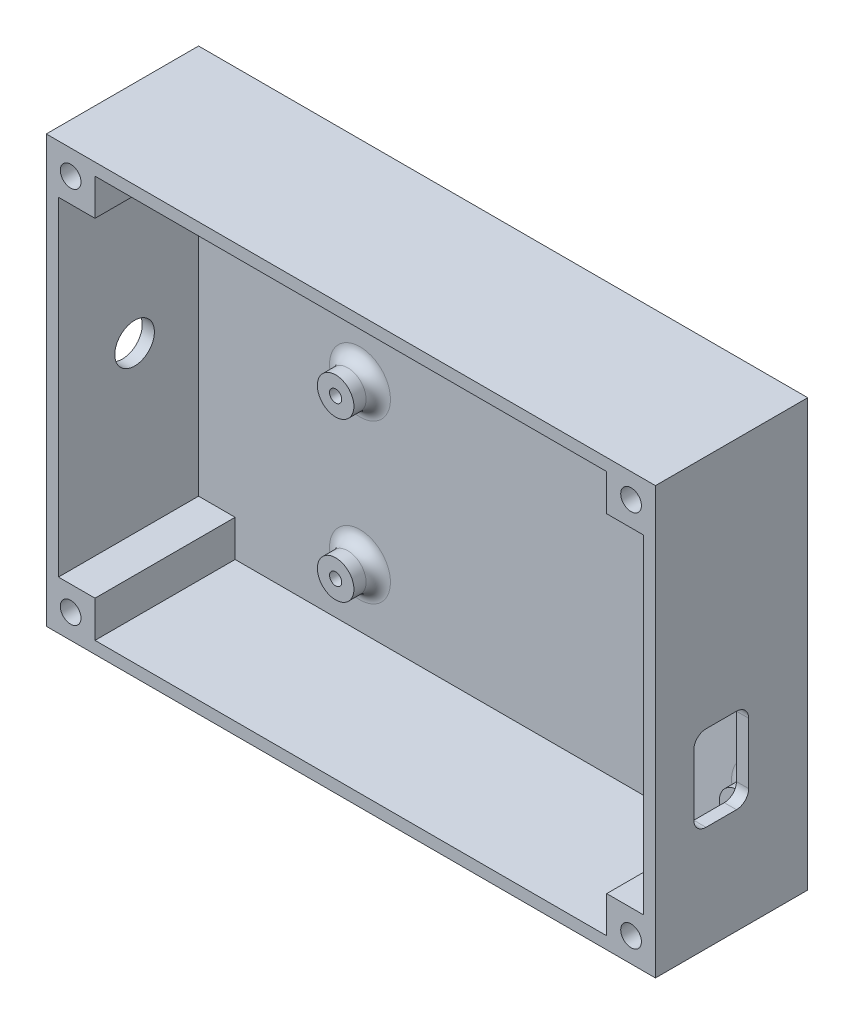
from build123d import *

# Parameters (mm, degrees)
SKIZZE1_W                              = 100
SKIZZE1_H                              = 70
AUFSATZ_LINEAR_AUSTRAGEN1_DEPTH        = 25
WANDUNG1_T                             = -2
SKIZZE2_W                              = 6
SKIZZE2_H                              = 6
AUFSATZ_LINEAR_AUSTRAGEN2_DEPTH        = 23
SKIZZE5_W                              = 76.2
SKIZZE5_H                              = 21.5
SCHNITT_LINEAR_AUSTRAGEN3_DEPTH        = 0.5
SKIZZE6_R                              = 3
AUFSATZ_LINEAR_AUSTRAGEN7_DEPTH        = 4
F_2_0_2_DURCHMESSER_BOHRUNG1_D         = 2
F_2_0_2_DURCHMESSER_BOHRUNG1_DEPTH     = 4
F_2_0_2_DURCHMESSER_BOHRUNG1_TIP       = 0.600860619
SCHNITT_LINEAR_AUSTRAGEN_USB_REACH     = 126.599
SKIZZE3_W                              = 9
SKIZZE3_H                              = 14
SCHNITT_LINEAR_AUSTRAGEN_ANTENNE_REACH = 126.599
SKIZZE4_R                              = 3.25
F_3_4_3_4_DURCHMESSER_BOHRUNG1_D       = 3.4
F_3_4_3_4_DURCHMESSER_BOHRUNG1_DEPTH   = 6
F_3_4_3_4_DURCHMESSER_BOHRUNG1_TIP     = 1.021463052
VERRUNDUNG1_R                          = 2
VERRUNDUNG2_R                          = 2


with BuildPart() as part:
    # Skizze1 → Aufsatz-Linear austragen1 (new body)
    with BuildSketch(Plane.XY):
        with Locations((-50, -35)):
            Rectangle(SKIZZE1_W, SKIZZE1_H)
    extrude(amount=AUFSATZ_LINEAR_AUSTRAGEN1_DEPTH)

    # Wandung1
    wandung1_openings = [part.faces().sort_by_distance(p)[0] for p in [
        (-50, -35, 25),
    ]]
    offset(amount=WANDUNG1_T, openings=wandung1_openings, kind=Kind.INTERSECTION)

    # Skizze2 → Aufsatz-Linear austragen2 (add)
    with BuildSketch(Plane.XY.offset(2)):
        with Locations((-95, -5)):
            Rectangle(SKIZZE2_W, SKIZZE2_H)
        with Locations((-5, -5)):
            Rectangle(SKIZZE2_W, SKIZZE2_H)
        with Locations((-5, -65)):
            Rectangle(SKIZZE2_W, SKIZZE2_H)
        with Locations((-95, -65)):
            Rectangle(SKIZZE2_W, SKIZZE2_H)
    extrude(amount=AUFSATZ_LINEAR_AUSTRAGEN2_DEPTH)

    # Skizze5 → Schnitt-Linear austragen3 (cut)
    with BuildSketch(Plane.XY.offset(2)):
        with Locations((-47.1, -13.75)):
            Rectangle(SKIZZE5_W, SKIZZE5_H)
    extrude(amount=-SCHNITT_LINEAR_AUSTRAGEN3_DEPTH, mode=Mode.SUBTRACT)

    # Skizze6 → Aufsatz-Linear austragen7 (add)
    with BuildSketch(Plane.XY.offset(2)):
        with Locations(Location((-5.5, -58.5, 0), (0, 0, 180))):
            Circle(SKIZZE6_R)
        with Locations(Location((-5.5, -32.5, 0), (0, 0, 180))):
            Circle(SKIZZE6_R)
        with Locations(Location((-71.5, -32.5, 0), (0, 0, 180))):
            Circle(SKIZZE6_R)
        with Locations(Location((-71.5, -58.5, 0), (0, 0, 180))):
            Circle(SKIZZE6_R)
    extrude(amount=AUFSATZ_LINEAR_AUSTRAGEN7_DEPTH)

    # Ø2.0 (2) Durchmesser Bohrung1
    with Locations(Plane.XY.offset(6)):
        with Locations((-71.5, -32.5), (-71.5, -58.5), (-5.5, -32.5), (-5.5, -58.5)):
            Hole(F_2_0_2_DURCHMESSER_BOHRUNG1_D / 2, depth=F_2_0_2_DURCHMESSER_BOHRUNG1_DEPTH)
            with Locations((0, 0, -(F_2_0_2_DURCHMESSER_BOHRUNG1_DEPTH + F_2_0_2_DURCHMESSER_BOHRUNG1_TIP / 2))):  # 118° drill point
                Cone(0, F_2_0_2_DURCHMESSER_BOHRUNG1_D / 2, F_2_0_2_DURCHMESSER_BOHRUNG1_TIP, mode=Mode.SUBTRACT)

    # Skizze3 → Schnitt-Linear austragen USB (cut, up to next)
    with BuildSketch(Plane(origin=(0, 0, 0), x_dir=(0, 0, -1), z_dir=(1, 0, 0)), mode=Mode.PRIVATE) as schnitt_linear_austragen_usb_sk1:
        with Locations((-14.2, -45.724218214)):
            Rectangle(SKIZZE3_W, SKIZZE3_H)
    schnitt_linear_austragen_usb_tool1 = extrude(schnitt_linear_austragen_usb_sk1.sketch, amount=-SCHNITT_LINEAR_AUSTRAGEN_USB_REACH, mode=Mode.PRIVATE) & part.part
    add(schnitt_linear_austragen_usb_tool1.solids().sort_by_distance((0, -45.724218, 14.2))[0], mode=Mode.SUBTRACT)

    # Skizze4 → Schnitt-Linear austragen Antenne (cut, up to next)
    with BuildSketch(Plane.ZY.offset(100), mode=Mode.PRIVATE) as schnitt_linear_austragen_antenne_sk1:
        with Locations((12.5, -35)):
            Circle(SKIZZE4_R)
    schnitt_linear_austragen_antenne_tool1 = extrude(schnitt_linear_austragen_antenne_sk1.sketch, amount=-SCHNITT_LINEAR_AUSTRAGEN_ANTENNE_REACH, mode=Mode.PRIVATE) & part.part
    add(schnitt_linear_austragen_antenne_tool1.solids().sort_by_distance((-100, -35, 12.5))[0], mode=Mode.SUBTRACT)

    # Ø3.4 (3.4) Durchmesser Bohrung1
    with Locations(Plane.XY.offset(25)):
        with Locations((-96, -4), (-4, -4), (-4, -66), (-96, -66)):
            Hole(F_3_4_3_4_DURCHMESSER_BOHRUNG1_D / 2, depth=F_3_4_3_4_DURCHMESSER_BOHRUNG1_DEPTH)
            with Locations((0, 0, -(F_3_4_3_4_DURCHMESSER_BOHRUNG1_DEPTH + F_3_4_3_4_DURCHMESSER_BOHRUNG1_TIP / 2))):  # 118° drill point
                Cone(0, F_3_4_3_4_DURCHMESSER_BOHRUNG1_D / 2, F_3_4_3_4_DURCHMESSER_BOHRUNG1_TIP, mode=Mode.SUBTRACT)

    # Verrundung1
    verrundung1_edges = [part.edges().sort_by_distance(p)[0] for p in [
        (-1, -38.724218214, 9.7),
        (-1, -52.724218214, 9.7),
        (-1, -52.724218214, 18.7),
        (-1, -38.724218214, 18.7),
    ]]
    fillet(verrundung1_edges, radius=VERRUNDUNG1_R)

    # Verrundung2
    # the kernel refuses this fillet: 2 mm, written as the material it adds along each edge
    with BuildSketch(Plane(origin=(-5.5, -58.5, 2), x_dir=(-1, 0, 0), z_dir=(0, 1, 0))) as verrundung2_piece_1:
        with BuildLine():
            CenterArc((3 + VERRUNDUNG2_R, VERRUNDUNG2_R), VERRUNDUNG2_R, 180, 90)
            Line((3, VERRUNDUNG2_R), (3, 0))
            Line((3, 0), (3 + VERRUNDUNG2_R, 0))
        make_face()
    revolve(axis=Axis((-5.5, -58.5, 2), (0, 0, 1)))
    with BuildSketch(Plane(origin=(-71.5, -32.5, 2), x_dir=(-1, 0, 0), z_dir=(0, 1, 0))) as verrundung2_piece_2:
        with BuildLine():
            CenterArc((3 + VERRUNDUNG2_R, VERRUNDUNG2_R), VERRUNDUNG2_R, 180, 90)
            Line((3, VERRUNDUNG2_R), (3, 0))
            Line((3, 0), (3 + VERRUNDUNG2_R, 0))
        make_face()
    revolve(axis=Axis((-71.5, -32.5, 2), (0, 0, 1)))
    with BuildSketch(Plane(origin=(-5.5, -32.5, 2), x_dir=(-1, 0, 0), z_dir=(0, 1, 0))) as verrundung2_piece_3:
        with BuildLine():
            CenterArc((3 + VERRUNDUNG2_R, VERRUNDUNG2_R), VERRUNDUNG2_R, 180, 90)
            Line((3, VERRUNDUNG2_R), (3, 0))
            Line((3, 0), (3 + VERRUNDUNG2_R, 0))
        make_face()
    revolve(axis=Axis((-5.5, -32.5, 2), (0, 0, 1)))
    with BuildSketch(Plane(origin=(-71.5, -58.5, 2), x_dir=(-1, 0, 0), z_dir=(0, 1, 0))) as verrundung2_piece_4:
        with BuildLine():
            CenterArc((3 + VERRUNDUNG2_R, VERRUNDUNG2_R), VERRUNDUNG2_R, 180, 90)
            Line((3, VERRUNDUNG2_R), (3, 0))
            Line((3, 0), (3 + VERRUNDUNG2_R, 0))
        make_face()
    revolve(axis=Axis((-71.5, -58.5, 2), (0, 0, 1)))


solid = part.part
